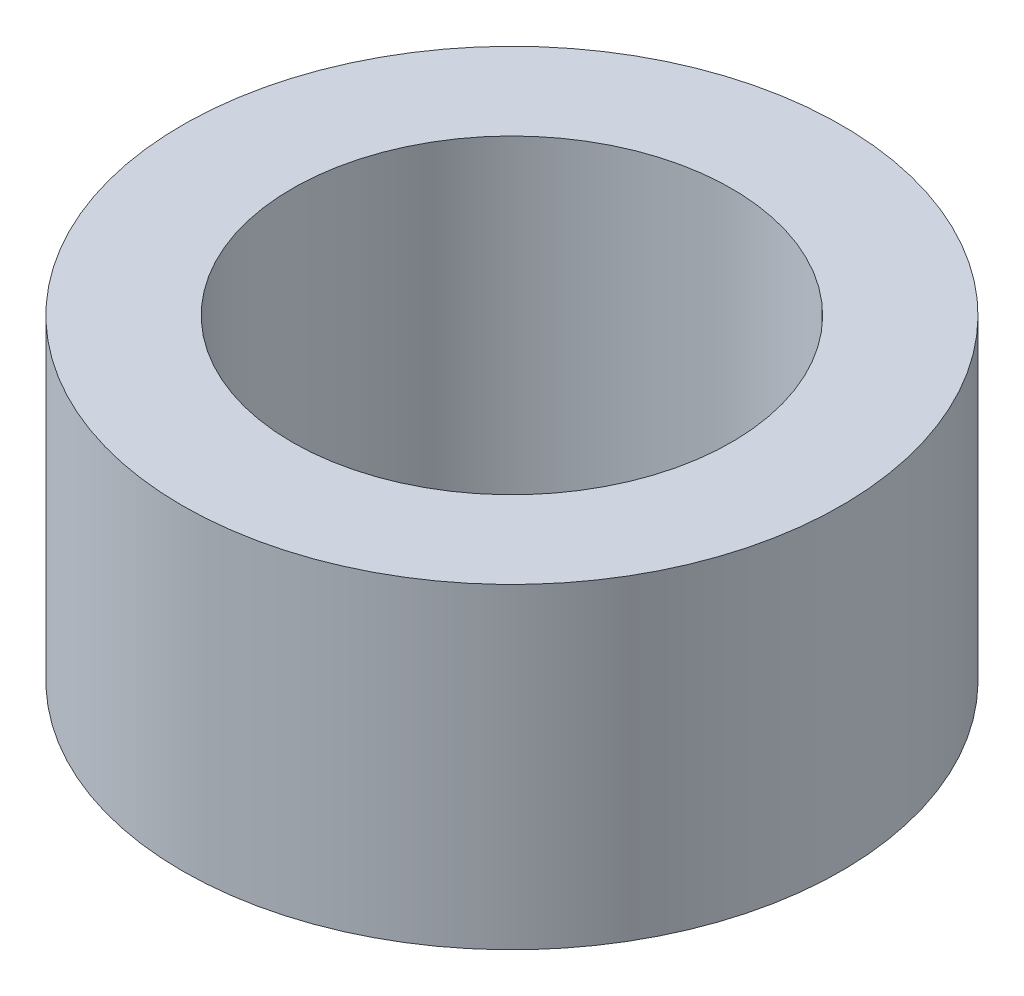
from build123d import *

# Parameters (mm, degrees)
SKETCH1_R           = 9.525
SKETCH1_R_2         = 6.35
BOSS_EXTRUDE1_DEPTH = 9.144


with BuildPart() as part:
    # Sketch1 → Boss-Extrude1 (new body)
    with BuildSketch(Plane(origin=(0, 0, 0), x_dir=(1, 0, 0), z_dir=(0, 1, 0))):
        Circle(SKETCH1_R)
        Circle(SKETCH1_R_2, mode=Mode.SUBTRACT)
    extrude(amount=BOSS_EXTRUDE1_DEPTH)


solid = part.part
